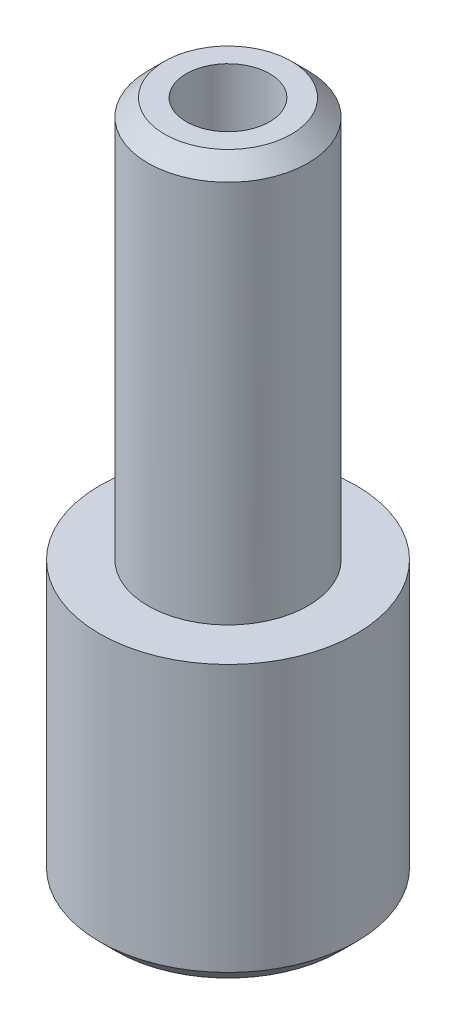
from build123d import *

# Parameters (mm, degrees)
CHAMFER1_SIZE = 0.5


with BuildPart() as part:
    # Sketch1 → Revolve1 (revolve)
    with BuildSketch(Plane.XY):
        Polygon((1.25, 0), (1.25, 20.5), (2.4, 20.5), (2.4, 8.5), (3.85, 8.5), (3.85, 0), align=None)
    revolve(axis=Axis((0, 9.717567568, 0), (0, -1, 0)))

    # Chamfer1
    chamfer1_edges = [part.edges().sort_by_distance(p)[0] for p in [
        (-2.4, 20.5, 0),
        (-3.85, 0, 0),
    ]]
    chamfer(chamfer1_edges, length=CHAMFER1_SIZE)


solid = part.part
